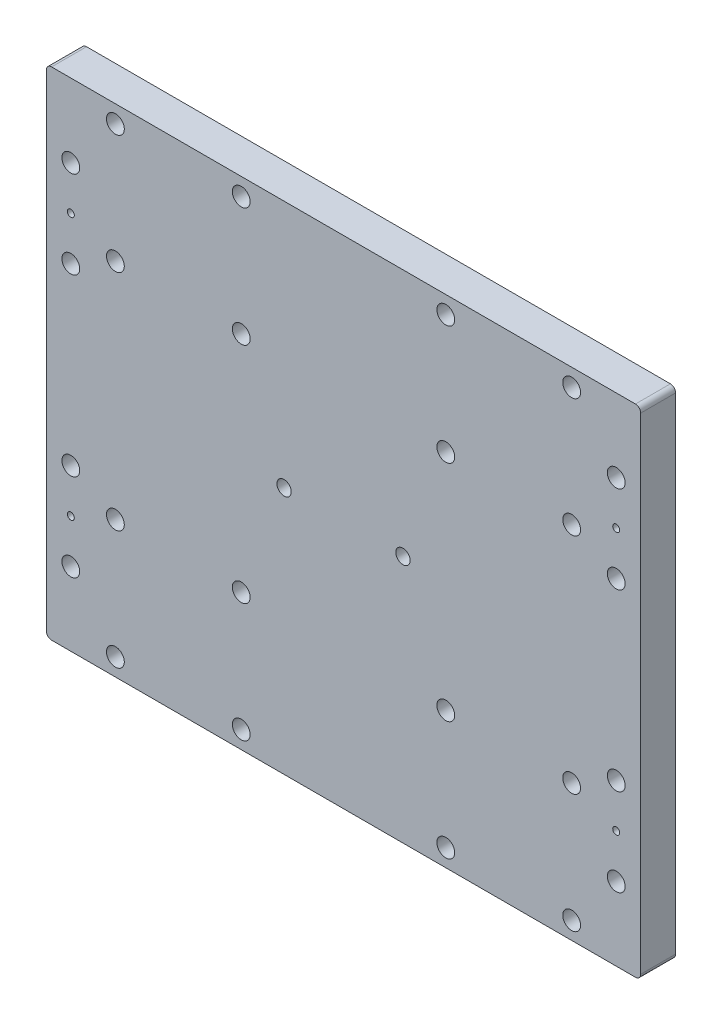
from build123d import *

# Parameters (mm, degrees)
SKETCH1_W           = 170
SKETCH1_H           = 142
BOSS_EXTRUDE1_DEPTH = 5
SKETCH2_R           = 2.55
CUT_EXTRUDE1_DEPTH  = 112.202517957
SKETCH4_R           = 2.05
CUT_EXTRUDE3_DEPTH  = 112.202517957
FILLET1_R           = 1.5
SKETCH6_R           = 2.55
SKETCH6_R_2         = 1
CUT_EXTRUDE5_DEPTH  = 112.202517957


with BuildPart() as part:
    # Sketch1 → Boss-Extrude1 (new, symmetric)
    with BuildSketch(Plane.XY):
        Rectangle(SKETCH1_W, SKETCH1_H)
    extrude(amount=BOSS_EXTRUDE1_DEPTH, both=True)

    # Sketch2 → Cut-Extrude1 (cut, through all)
    with BuildSketch(Plane.XY.offset(5)):
        with Locations((-65.25, 66)):
            Circle(SKETCH2_R)
        with Locations((-29.25, 66)):
            Circle(SKETCH2_R)
        with Locations((-29.25, 32)):
            Circle(SKETCH2_R)
        with Locations((-65.25, 32)):
            Circle(SKETCH2_R)
        with Locations((65.25, 66)):
            Circle(SKETCH2_R)
        with Locations((65.25, 32)):
            Circle(SKETCH2_R)
        with Locations((29.25, 32)):
            Circle(SKETCH2_R)
        with Locations((29.25, 66)):
            Circle(SKETCH2_R)
        with Locations((-65.25, -32)):
            Circle(SKETCH2_R)
        with Locations((-29.25, -32)):
            Circle(SKETCH2_R)
        with Locations((-29.25, -66)):
            Circle(SKETCH2_R)
        with Locations((-65.25, -66)):
            Circle(SKETCH2_R)
        with Locations((29.25, -32)):
            Circle(SKETCH2_R)
        with Locations((65.25, -32)):
            Circle(SKETCH2_R)
        with Locations((65.25, -66)):
            Circle(SKETCH2_R)
        with Locations((29.25, -66)):
            Circle(SKETCH2_R)
    extrude(amount=-CUT_EXTRUDE1_DEPTH, mode=Mode.SUBTRACT)

    # Sketch4 → Cut-Extrude3 (cut, through all)
    with BuildSketch(Plane.XY.offset(5)):
        with Locations((-17, 0)):
            Circle(SKETCH4_R)
        with Locations((17, 0)):
            Circle(SKETCH4_R)
    extrude(amount=-CUT_EXTRUDE3_DEPTH, mode=Mode.SUBTRACT)

    # Fillet1
    fillet1_edges = [part.edges().sort_by_distance(p)[0] for p in [
        (-85, -71, 0),
        (85, -71, 0),
        (85, 71, 0),
        (-85, 71, 0),
    ]]
    fillet(fillet1_edges, radius=FILLET1_R)

    # Sketch6 → Cut-Extrude5 (cut, through all)
    with BuildSketch(Plane.XY.offset(5)):
        with Locations((-78, 50)):
            Circle(SKETCH6_R)
        with Locations((-78, 37.5)):
            Circle(SKETCH6_R_2)
        with Locations((-78, 25)):
            Circle(SKETCH6_R)
        with Locations((-78, -25)):
            Circle(SKETCH6_R)
        with Locations((-78, -37.5)):
            Circle(SKETCH6_R_2)
        with Locations((-78, -50)):
            Circle(SKETCH6_R)
    cut_extrude5 = extrude(amount=-CUT_EXTRUDE5_DEPTH, mode=Mode.SUBTRACT)

    # Mirror1: Cut-Extrude5 across plane
    add(cut_extrude5.mirror(Plane(origin=(0, 0, 0), x_dir=(0, 0, 1), z_dir=(1, 0, 0))), mode=Mode.SUBTRACT)


solid = part.part
